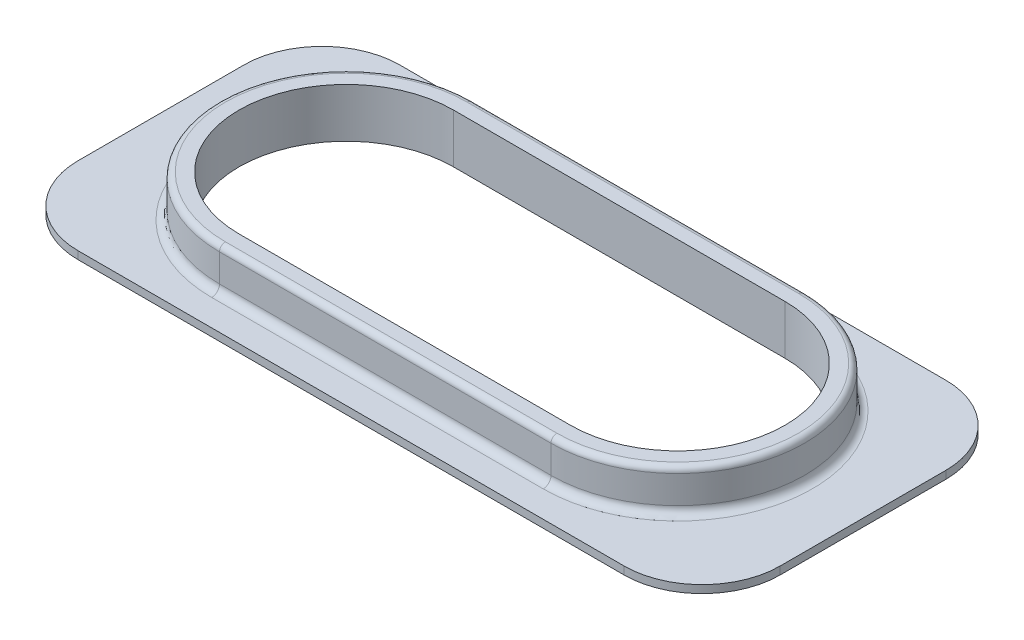
from build123d import *

# Parameters (mm, degrees)
BOSS_EXTRUDE1_DEPTH     = 2.125
BOSS_EXTRUDE3_START     = -0.4
BOSS_EXTRUDE3_OUTLINE_W = 36
BOSS_EXTRUDE3_OUTLINE_H = 16.5
BOSS_EXTRUDE3_DEPTH     = 0.4
FILLET1_R               = 4
FILLET2_R               = 4
FILLET3_R               = 0.3
FILLET4_R               = 0.4


# Read off the part's stored shape, not the designer's step: Boss-Extrude3
with BuildPart() as part:
    # Sketch1 → Boss-Extrude1 (new body)
    with BuildSketch(Plane(origin=(0, 0, 0), x_dir=(1, 0, 0), z_dir=(0, 1, 0))):
        with BuildLine():
            Line((-9.970479705, 7.970479705), (7.029520295, 7.970479705))
            ThreePointArc((7.029520295, 7.970479705), (13.529520295, 1.470479705), (7.029520295, -5.029520295))
            Line((7.029520295, -5.029520295), (-9.970479705, -5.029520295))
            ThreePointArc((-9.970479705, -5.029520295), (-16.470479705, 1.470479705), (-9.970479705, 7.970479705))
        make_face()
        with BuildLine():
            Line((-9.970479705, 6.970479705), (7.029520295, 6.970479705))
            ThreePointArc((7.029520295, 6.970479705), (12.529520295, 1.470479705), (7.029520295, -4.029520295))
            Line((7.029520295, -4.029520295), (-9.970479705, -4.029520295))
            ThreePointArc((-9.970479705, -4.029520295), (-15.470479705, 1.470479705), (-9.970479705, 6.970479705))
        make_face(mode=Mode.SUBTRACT)
    extrude(amount=BOSS_EXTRUDE1_DEPTH)

    # Boss-Extrude3 outline → Boss-Extrude3 (add)
    with BuildSketch(Plane(origin=(0, 0, 0), x_dir=(1, 0, 0), z_dir=(0, 1, 0)).offset(BOSS_EXTRUDE3_START)):
        with Locations((-1.470479705, 1.470479705)):
            Rectangle(BOSS_EXTRUDE3_OUTLINE_W, BOSS_EXTRUDE3_OUTLINE_H)
        with BuildLine():
            Line((7.029520295, -4.029520295), (-9.970479705, -4.029520295))
            ThreePointArc((-9.970479705, -4.029520295), (-15.470479705, 1.470479705), (-9.970479705, 6.970479705))
            Line((-9.970479705, 6.970479705), (7.029520295, 6.970479705))
            ThreePointArc((7.029520295, 6.970479705), (12.529520295, 1.470479705), (7.029520295, -4.029520295))
        make_face(mode=Mode.SUBTRACT)
    extrude(amount=BOSS_EXTRUDE3_DEPTH)

    # Fillet1
    fillet1_edges = [part.edges().sort_by_distance(p)[0] for p in [
        (-19.470479705, -0.2, 6.779520295),
    ]]
    fillet(fillet1_edges, radius=FILLET1_R)

    # Fillet2
    fillet2_edges = [part.edges().sort_by_distance(p)[0] for p in [
        (16.529520295, -0.2, 6.779520295),
        (-19.470479705, -0.2, -9.720479705),
        (16.529520295, -0.2, -9.720479705),
    ]]
    fillet(fillet2_edges, radius=FILLET2_R)

    # Fillet3
    fillet3_edges = [part.edges().sort_by_distance(p)[0] for p in [
        (13.529520295, 2.125, -1.470479705),
        (-1.470479705, 2.125, -7.970479705),
        (-16.470479705, 2.125, -1.470479705),
        (-1.470479705, 2.125, 5.029520295),
    ]]
    fillet(fillet3_edges, radius=FILLET3_R)

    # Fillet4
    fillet4_edges = [part.edges().sort_by_distance(p)[0] for p in [
        (-1.470479705, 0, -7.970479705),
        (13.529520295, 0, -1.470479705),
        (-1.470479705, 0, 5.029520295),
        (-16.470479705, 0, -1.470479705),
    ]]
    fillet(fillet4_edges, radius=FILLET4_R)


solid = part.part
